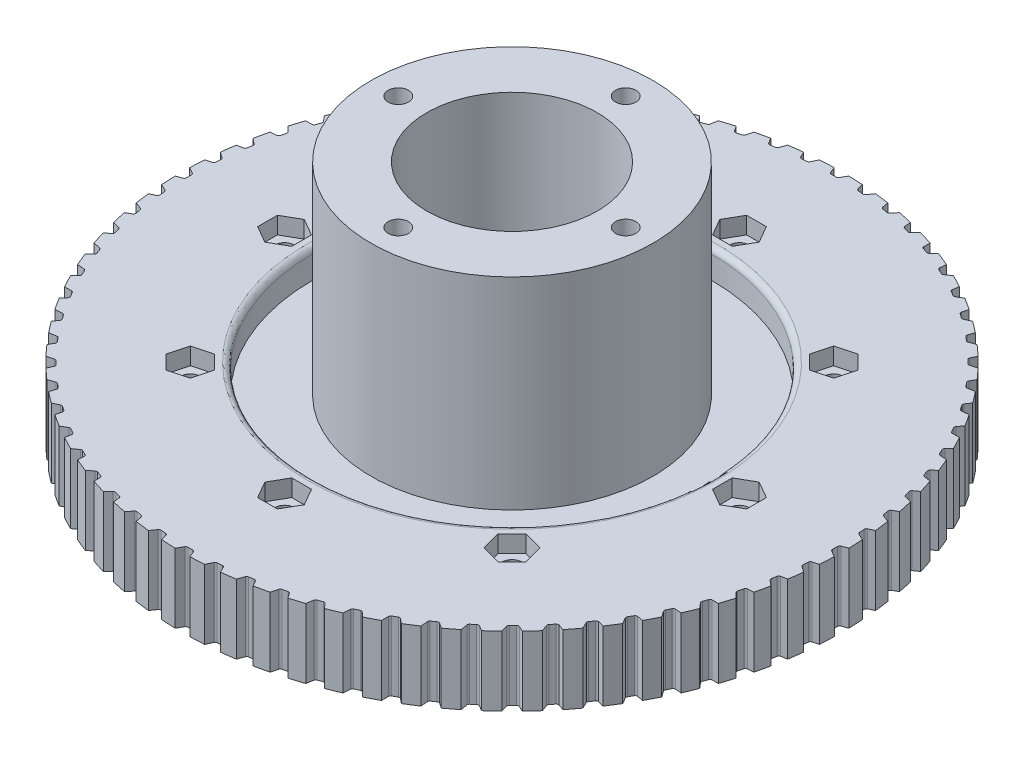
from build123d import *

# Parameters (mm, degrees)
SKETCH1_R               = 57.9628
BOSS_EXTRUDE1_DEPTH     = 12.192
CUT_EXTRUDE1_DEPTH      = 83.873501384
CIRPATTERN1_COUNT       = 72
SKETCH3_R               = 24.8
BOSS_EXTRUDE2_DEPTH     = 30.5
CUT_EXTRUDE2_DEPTH      = 93.405248669
CUT_EXTRUDE2_DEPTH_BACK = 93.405248669
SKETCH4_R               = 15
SKETCH5_R               = 1.7
CUT_EXTRUDE3_DEPTH      = 93.405248669
CUT_EXTRUDE4_DEPTH      = 3
CIRPATTERN2_COUNT       = 8
CUT_EXTRUDE5_START      = -5
SKETCH7_R               = 35
SKETCH7_R_2             = 24.8
CUT_EXTRUDE5_DEPTH      = 5
FILLET1_R               = 1
SKETCH8_R               = 1.8
CUT_EXTRUDE6_DEPTH      = 93.405248669
CIRPATTERN3_COUNT       = 4


with BuildPart() as part:
    # Sketch1 → Boss-Extrude1 (new body)
    with BuildSketch(Plane(origin=(0, 0, 0), x_dir=(1, 0, 0), z_dir=(0, 1, 0))):
        Circle(SKETCH1_R)
    extrude(amount=BOSS_EXTRUDE1_DEPTH)

    # Sketch2 → Cut-Extrude1 (cut, symmetric)
    with BuildSketch(Plane(origin=(0, 12.192, 0), x_dir=(1, 0, 0), z_dir=(0, 1, 0))):
        with BuildLine():
            Line((-1.2827, 57.9628), (-1.2827, 83.3628))
            Line((-1.2827, 83.3628), (1.2827, 83.3628))
            Line((1.2827, 83.3628), (1.2827, 57.9628))
            Line((1.2827, 57.9628), (0.659450384, 56.8833))
            ThreePointArc((0.659450384, 56.8833), (0.519994706, 56.743844321), (0.329494706, 56.6928))
            Line((0.329494706, 56.6928), (-0.55367873, 56.6928))
            ThreePointArc((-0.55367873, 56.6928), (-0.772211353, 56.761703071), (-0.911701619, 56.943490325))
            Line((-0.911701619, 56.943490325), (-1.2827, 57.9628))
        make_face()
    cut_extrude1 = extrude(amount=CUT_EXTRUDE1_DEPTH, both=True, mode=Mode.SUBTRACT)

    # CirPattern1: Cut-Extrude1 ×72 about axis
    cirpattern1_axis = Axis((0, 12.192, 0), (0, -1, 0))
    for i in range(1, CIRPATTERN1_COUNT):
        add(cut_extrude1.rotate(cirpattern1_axis, i * 360 / CIRPATTERN1_COUNT), mode=Mode.SUBTRACT)

    # Sketch3 → Boss-Extrude2 (add)
    with BuildSketch(Plane(origin=(0, 12.192, 0), x_dir=(1, 0, 0), z_dir=(0, 1, 0))):
        Circle(SKETCH3_R)
    extrude(amount=BOSS_EXTRUDE2_DEPTH)

    # Sketch4 → Cut-Extrude2 (cut, two sides: drawn at the far end of the back side and taken through both)
    with BuildSketch(Plane(origin=(0, 42.692, 0), x_dir=(1, 0, 0), z_dir=(0, 1, 0)).offset(-CUT_EXTRUDE2_DEPTH_BACK)):
        Circle(SKETCH4_R)
    extrude(amount=CUT_EXTRUDE2_DEPTH + CUT_EXTRUDE2_DEPTH_BACK, mode=Mode.SUBTRACT)

    # Sketch5 → Cut-Extrude3 (cut, symmetric)
    with BuildSketch(Plane.XZ):
        with Locations((0, -40)):
            Circle(SKETCH5_R)
    cut_extrude3 = extrude(amount=CUT_EXTRUDE3_DEPTH, both=True, mode=Mode.SUBTRACT)

    # Sketch6 → Cut-Extrude4 (cut)
    with BuildSketch(Plane.XZ.offset(-12.192)):
        Polygon((3.464101615, -40), (1.732050808, -37), (-1.732050808, -37), (-3.464101615, -40), (-1.732050808, -43), (1.732050808, -43), align=None)
    cut_extrude4 = extrude(amount=CUT_EXTRUDE4_DEPTH, mode=Mode.SUBTRACT)

    # CirPattern2: Cut-Extrude3, Cut-Extrude4 ×8 about axis
    cirpattern2_axis = Axis((0, 0, 0), (0, 1, 0))
    add([cut_extrude3.rotate(cirpattern2_axis, i * 360 / CIRPATTERN2_COUNT) for i in range(1, CIRPATTERN2_COUNT)], mode=Mode.SUBTRACT)
    add([cut_extrude4.rotate(cirpattern2_axis, i * 360 / CIRPATTERN2_COUNT) for i in range(1, CIRPATTERN2_COUNT)], mode=Mode.SUBTRACT)

    # Sketch7 → Cut-Extrude5 (cut)
    with BuildSketch(Plane(origin=(0, 12.192, 0), x_dir=(1, 0, 0), z_dir=(0, 1, 0)).offset(CUT_EXTRUDE5_START)):
        Circle(SKETCH7_R)
        Circle(SKETCH7_R_2, mode=Mode.SUBTRACT)
    extrude(amount=CUT_EXTRUDE5_DEPTH, mode=Mode.SUBTRACT)

    # Fillet1
    fillet1_edges = [part.edges().sort_by_distance(p)[0] for p in [
        (-35, 12.192, 0),
    ]]
    fillet(fillet1_edges, radius=FILLET1_R)

    # Sketch8 → Cut-Extrude6 (cut, symmetric)
    with BuildSketch(Plane.XZ):
        with Locations((0, -20)):
            Circle(SKETCH8_R)
    cut_extrude6 = extrude(amount=CUT_EXTRUDE6_DEPTH, both=True, mode=Mode.SUBTRACT)

    # CirPattern3: Cut-Extrude6 ×4 about axis
    cirpattern3_axis = Axis((0, 0, 0), (0, 1, 0))
    for i in range(1, CIRPATTERN3_COUNT):
        add(cut_extrude6.rotate(cirpattern3_axis, i * 360 / CIRPATTERN3_COUNT), mode=Mode.SUBTRACT)


solid = part.part
